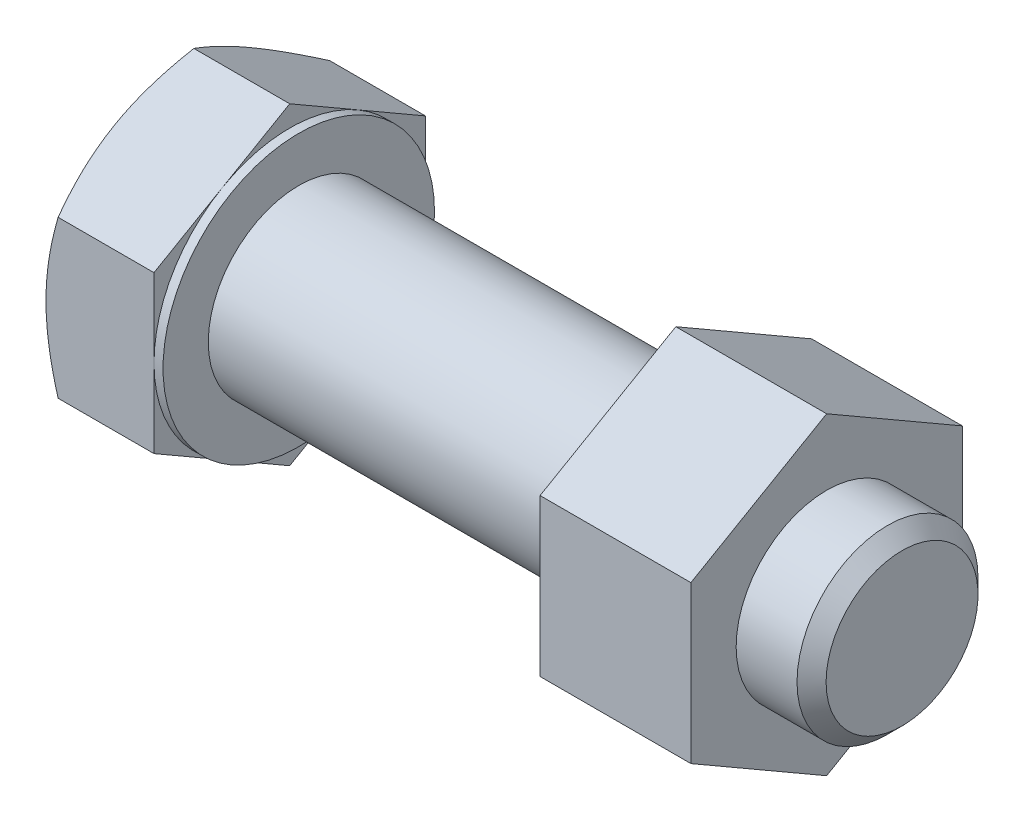
from build123d import *

# Parameters (mm, degrees)
BASEHEAD_DEPTH      = 7.76
SKETCH4_W           = 0.6
SKETCH4_H           = 11.392304845
BOSS_EXTRUDE1_DEPTH = 10


# Read off the part's stored shape, not the designer's step: HeadChamfer
with BuildPart() as part:
    # Sketch1 → BaseHead (new body)
    with BuildSketch(Plane(origin=(0, 0, 0), x_dir=(0, 0, -1), z_dir=(1, 0, 0))):
        Polygon((9, 5.196152423), (9, -5.196152423), (0, -10.392304845), (-9, -5.196152423), (-9, 5.196152423), (0, 10.392304845), align=None)
    extrude(amount=BASEHEAD_DEPTH)

    # HeadChamfer outline → HeadChamfer (revolve, cut)
    with BuildSketch(Plane.YX):
        Polygon((10.392304847, 0.803847578), (9, 0), (10.392304847, 0), align=None)
    revolve(axis=Axis((0, 0, 0), (1, 0, 0)), mode=Mode.SUBTRACT)

    # HeadChamfer 2 outline → HeadChamfer 2 (revolve)
    with BuildSketch(Plane.YX):
        Polygon((6, 7.76), (6, 46.796), (5.036, 47.76), (0, 47.76), (0, 7.76), align=None)
    revolve(axis=Axis((0, 0, 0), (1, 0, 0)))

    # Sketch4 → BearingFace (revolve, cut)
    with BuildSketch(Plane.XY, mode=Mode.PRIVATE) as bearingface_sk:
        with Locations((7.46, 14.696152423)):
            Rectangle(SKETCH4_W, SKETCH4_H)
    revolve(bearingface_sk.sketch.rotate(Axis((0, 0, 0), (1, 0, 0)), 90), axis=Axis((0, 0, 0), (1, 0, 0)), mode=Mode.SUBTRACT)

    # Sketch5 → Boss-Extrude1 (add)
    with BuildSketch(Plane(origin=(42.76, 0, 0), x_dir=(0, 0, -1), z_dir=(1, 0, 0))):
        Polygon((0, 10.392304845), (-9, 5.196152423), (-9, -5.196152423), (0, -10.392304845), (9, -5.196152423), (9, 5.196152423), align=None)
    extrude(amount=-BOSS_EXTRUDE1_DEPTH)


solid = part.part
